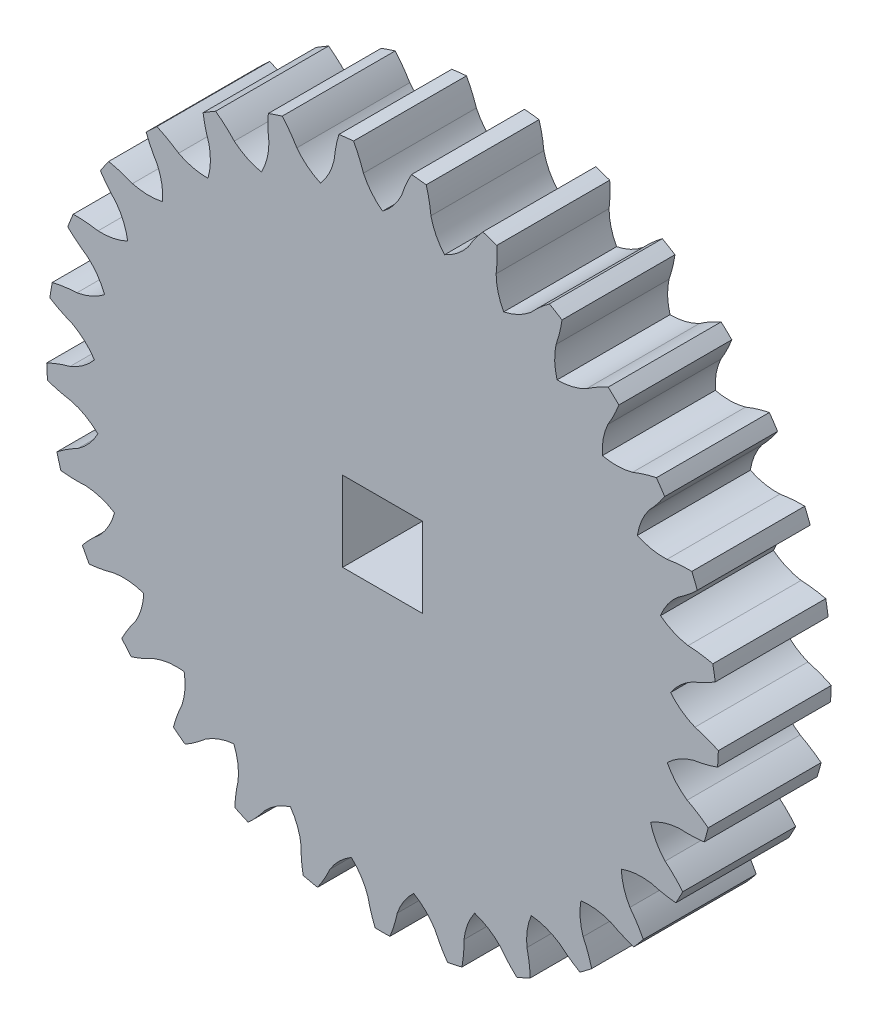
from build123d import *

# Parameters (mm, degrees)
SKETCH1_R           = 29.75
SKETCH1_W           = 7.071067812
SKETCH1_H           = 7.071067812
BOSS_EXTRUDE1_DEPTH = 10
CUT_EXTRUDE1_DEPTH  = 44.244941901
CIRPATTERN1_COUNT   = 29


with BuildPart() as part:
    # Sketch1 → Boss-Extrude1 (new body)
    with BuildSketch(Plane.XY):
        Circle(SKETCH1_R)
        Rectangle(SKETCH1_W, SKETCH1_H, mode=Mode.SUBTRACT)
    extrude(amount=BOSS_EXTRUDE1_DEPTH)

    # Sketch2 → Cut-Extrude1 (cut, through all)
    with BuildSketch(Plane.XY):
        with BuildLine():
            ThreePointArc((0, 25.543580948), (-0.974317868, 26.472596764), (-1.690877269, 27.612293356))
            ThreePointArc((-1.690877269, 27.612293356), (-3.707498788, 31.338974425), (-6.921804626, 34.099980061))
            ThreePointArc((-6.921804626, 34.099980061), (-3.661433163, 35.923952851), (0, 36.666115912))
            ThreePointArc((0, 36.666115912), (3.661433163, 35.923952851), (6.921804626, 34.099980061))
            ThreePointArc((6.921804626, 34.099980061), (3.707498788, 31.338974425), (1.690877269, 27.612293356))
            ThreePointArc((1.690877269, 27.612293356), (0.974317868, 26.472596764), (0, 25.543580948))
        make_face()
    cut_extrude1 = extrude(amount=CUT_EXTRUDE1_DEPTH, mode=Mode.SUBTRACT)

    # CirPattern1: Cut-Extrude1 ×29 about axis
    cirpattern1_axis = Axis((0, 0, 10), (0, 0, -1))
    for i in range(1, CIRPATTERN1_COUNT):
        add(cut_extrude1.rotate(cirpattern1_axis, i * 360 / CIRPATTERN1_COUNT), mode=Mode.SUBTRACT)


solid = part.part
